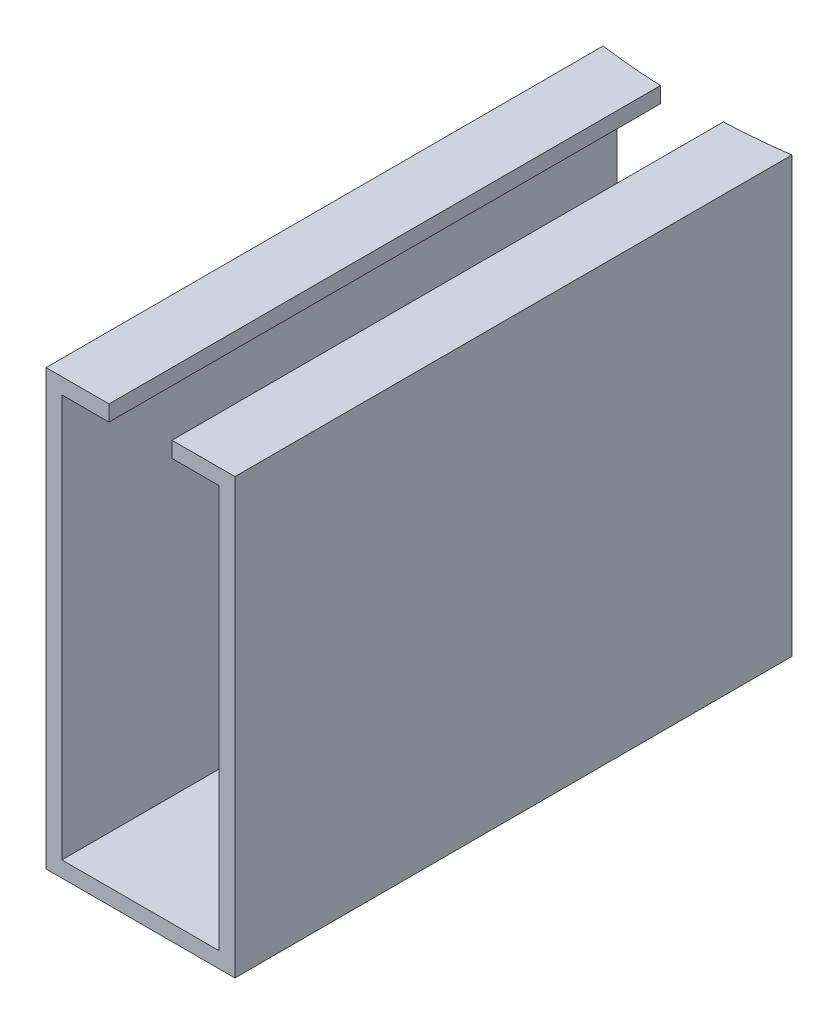
from build123d import *

# Parameters (mm, degrees)
EXTRUDE_1_DEPTH     = 40
SKETCH_2_R          = 22.5
CUT_EXTRUDE_1_DEPTH = 40


with BuildPart() as part:
    # ｽｹｯﾁ1 → ﾎﾞｽ - 押し出し1 (new body)
    with BuildSketch(Plane.XY):
        Polygon((0, 0), (5, 0), (5, 12.8), (3.5, 12.8), (3.5, 13.3), (5.5, 13.3), (5.5, 12.8), (5.5, -0.5), (-0.5, -0.5), (-0.5, 12.8), (-0.5, 13.3), (1.5, 13.3), (1.5, 12.8), (0, 12.8), align=None)
    extrude(amount=EXTRUDE_1_DEPTH)

    # ｽｹｯﾁ2 → ｶｯﾄ - 押し出し1 (cut)
    with BuildSketch(Plane.XZ.offset(0.5)):
        with Locations((2.5, 0)):
            Circle(SKETCH_2_R)
    extrude(amount=-CUT_EXTRUDE_1_DEPTH, mode=Mode.SUBTRACT)


solid = part.part
